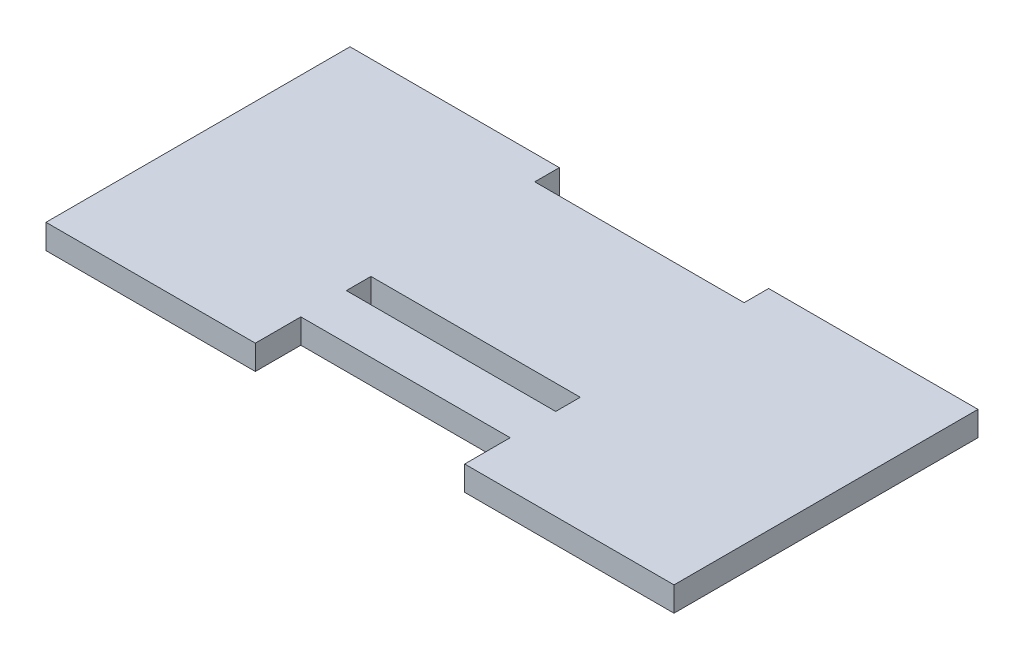
from build123d import *

# Parameters (mm, degrees)
SKETCH1_W           = 23
SKETCH1_H           = 2.7
BOSS_EXTRUDE1_DEPTH = 2.7


with BuildPart() as part:
    # Sketch1 → Boss-Extrude1 (new body)
    with BuildSketch(Plane(origin=(0, 0, 0), x_dir=(1, 0, 0), z_dir=(0, 1, 0))):
        Polygon((-34.5, 16.7), (-11.5, 16.7), (-11.5, 14), (11.5, 14), (11.5, 16.7), (34.5, 16.7), (34.5, -16.7), (11.5, -16.7), (11.5, -11.7), (-11.5, -11.7), (-11.5, -16.7), (-34.5, -16.7), align=None)
        with Locations((0, -5.35)):
            Rectangle(SKETCH1_W, SKETCH1_H, mode=Mode.SUBTRACT)
    extrude(amount=BOSS_EXTRUDE1_DEPTH)


solid = part.part
